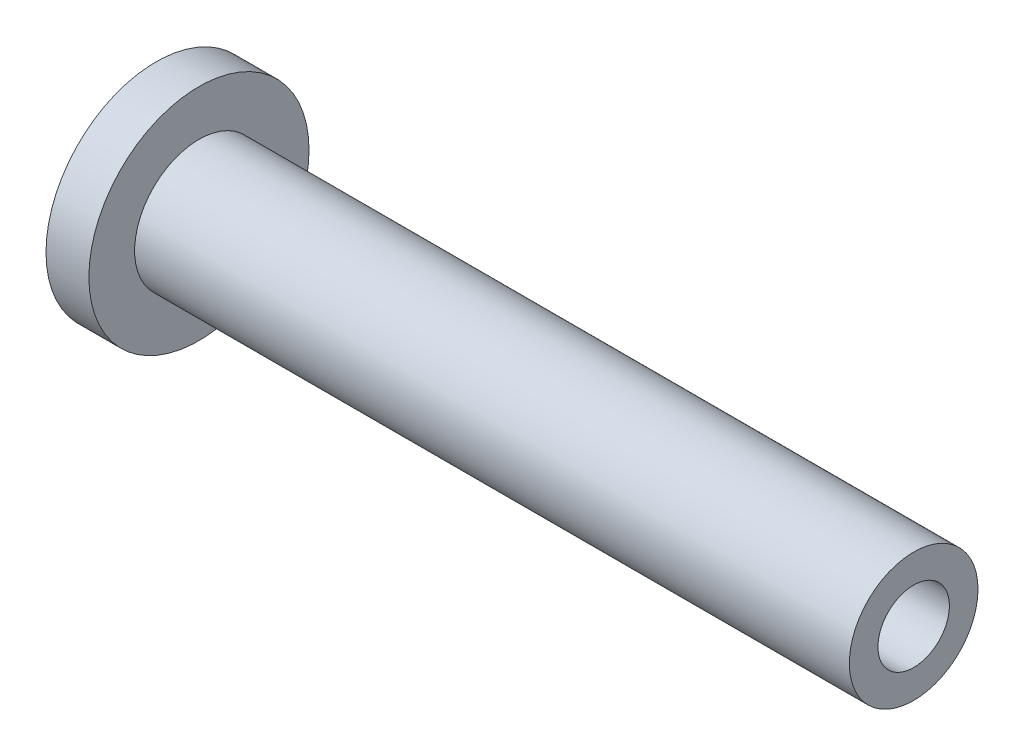
from build123d import *

# Parameters (mm, degrees)
BROCA_DE_ROSQUEAR_PARA_TARRAXA_DE_M61_D     = 5
BROCA_DE_ROSQUEAR_PARA_TARRAXA_DE_M61_DEPTH = 11
BROCA_DE_ROSQUEAR_PARA_TARRAXA_DE_M61_TIP   = 1.502151548


with BuildPart() as part:
    # Sketch1 → Revolve1 (revolve)
    with BuildSketch(Plane.XY):
        Polygon((0, 0), (0, 7.7), (3, 7.7), (3, 4.5), (53, 4.5), (53, 0), align=None)
    revolve(axis=Axis((0, 0, 0), (-1, 0, 0)))

    # Broca de rosquear para tarraxa de M61
    with Locations(Plane(origin=(53, 0, 0), x_dir=(0, 0, -1), z_dir=(1, 0, 0))):
        with Locations((0, 0)):
            Hole(BROCA_DE_ROSQUEAR_PARA_TARRAXA_DE_M61_D / 2, depth=BROCA_DE_ROSQUEAR_PARA_TARRAXA_DE_M61_DEPTH)
            with Locations((0, 0, -(BROCA_DE_ROSQUEAR_PARA_TARRAXA_DE_M61_DEPTH + BROCA_DE_ROSQUEAR_PARA_TARRAXA_DE_M61_TIP / 2))):  # 118° drill point
                Cone(0, BROCA_DE_ROSQUEAR_PARA_TARRAXA_DE_M61_D / 2, BROCA_DE_ROSQUEAR_PARA_TARRAXA_DE_M61_TIP, mode=Mode.SUBTRACT)


solid = part.part
